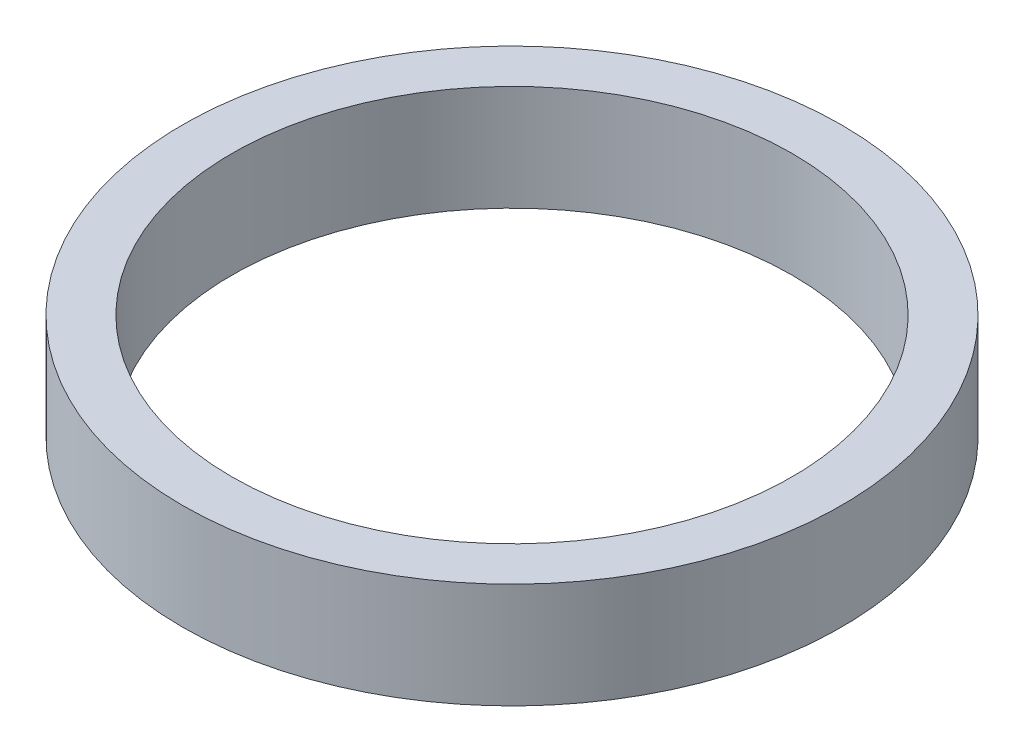
from build123d import *

# Parameters (mm, degrees)
SKETCH1_R           = 50
BOSS_EXTRUDE1_DEPTH = 16
SKETCH2_R           = 42.5
CUT_EXTRUDE1_DEPTH  = 73.498275842


with BuildPart() as part:
    # Sketch1 → Boss-Extrude1 (new body)
    with BuildSketch(Plane(origin=(0, 0, 0), x_dir=(1, 0, 0), z_dir=(0, 1, 0))):
        Circle(SKETCH1_R)
    extrude(amount=BOSS_EXTRUDE1_DEPTH)

    # Sketch2 → Cut-Extrude1 (cut, through all)
    with BuildSketch(Plane(origin=(0, 0, 0), x_dir=(1, 0, 0), z_dir=(0, 1, 0))):
        Circle(SKETCH2_R)
    extrude(amount=CUT_EXTRUDE1_DEPTH, mode=Mode.SUBTRACT)


solid = part.part
